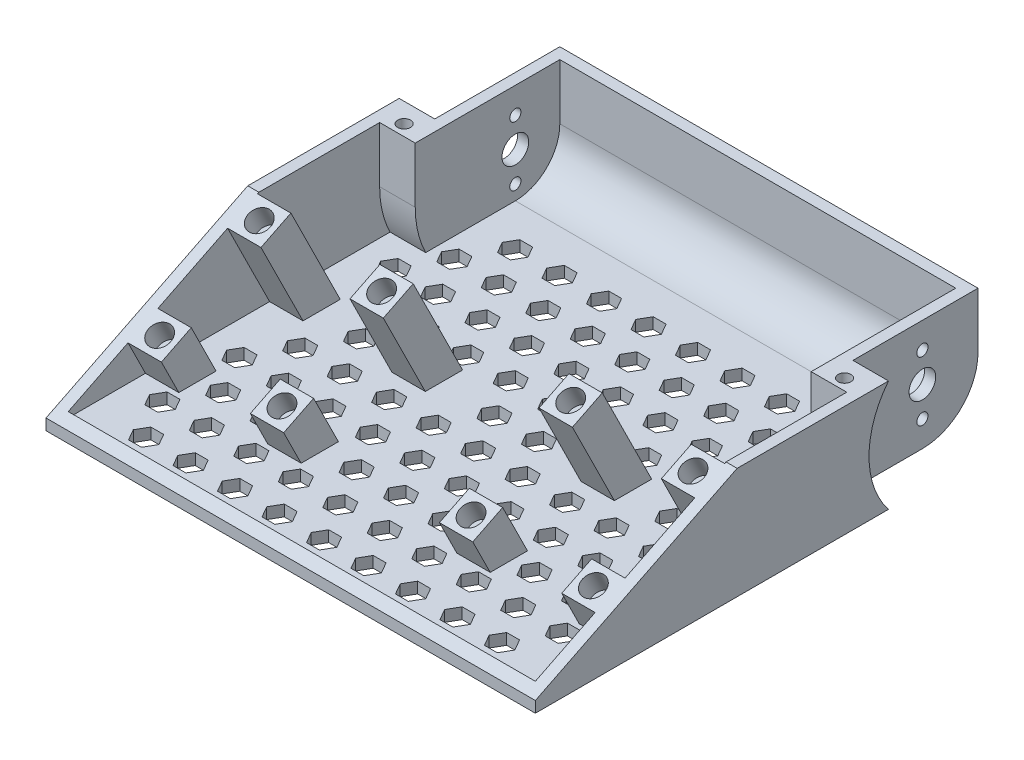
from build123d import *

# Parameters (mm, degrees)
BOSS_EXTRUDE2_DEPTH             = 69.85
SKETCH2_R                       = 25.4
CUT_EXTRUDE1_DEPTH              = 10.16
SHELL1_T                        = -3.175
M3_CLEARANCE_HOLE1_D            = 3.2
M3_CLEARANCE_HOLE1_CSINK_D      = 3.25
M3_CLEARANCE_HOLE1_CSINK_ANGLE  = 90
CUT_EXTRUDE2_DEPTH              = 156.206522817
BOSS_EXTRUDE3_REACH             = 120.195
SKETCH7_W                       = 9.525
SKETCH7_H                       = 9.525
F_1_4_0_25_DIAMETER_HOLE1_D     = 6.35
F_1_4_0_25_DIAMETER_HOLE1_DEPTH = 6.35
F_1_4_0_25_DIAMETER_HOLE1_TIP   = 1.907732465
BOSS_EXTRUDE4_REACH             = 112.397
BOSS_EXTRUDE4_END_RADIUS        = 28.575
SKETCH16_W                      = 10.16
SKETCH16_H                      = 4.815475594
F_6_CLEARANCE_HOLE1_D           = 3.6576
F_6_CLEARANCE_HOLE1_DEPTH       = 6.35
F_6_CLEARANCE_HOLE1_TIP         = 1.0988539
CUT_EXTRUDE3_REACH              = 111.526
FILL_PATTERN1_DEPTH             = 3.175


# Read off the part's stored shape, not the designer's step: Fill Pattern1
with BuildPart() as part:
    # Sketch1 → Boss-Extrude2 (new, symmetric)
    with BuildSketch(Plane(origin=(0, 0, 0), x_dir=(0, 0, -1), z_dir=(1, 0, 0))):
        with BuildLine():
            Line((-57.15, 3.15251797), (-57.15, 0))
            Line((-57.15, 0), (63.5, 0))
            ThreePointArc((63.5, 0), (74.725320151, 4.649679849), (79.375, 15.875))
            Line((79.375, 15.875), (79.375, 31.75))
            Line((79.375, 31.75), (0.452847189, 31.75))
            Line((0.452847189, 31.75), (-57.15, 3.15251797))
        make_face()
    extrude(amount=BOSS_EXTRUDE2_DEPTH, both=True)

    # Sketch2 → Cut-Extrude1 (cut)
    with BuildSketch(Plane(origin=(69.85, 0, 0), x_dir=(0, 0, -1), z_dir=(1, 0, 0))):
        with Locations((63.5, 15.875)):
            Circle(SKETCH2_R)
    cut_extrude1 = extrude(amount=-CUT_EXTRUDE1_DEPTH, mode=Mode.SUBTRACT)

    # Mirror1: Cut-Extrude1 across plane
    add(cut_extrude1.mirror(Plane(origin=(0, 0, 0), x_dir=(0, 0, 1), z_dir=(1, 0, 0))), mode=Mode.SUBTRACT)

    # Shell1
    shell1_openings = [part.faces().sort_by_distance(p)[0] for p in [
        (0, 17.451258985, 28.348576405),
        (0, 31.75, -38.391836194),
    ]]
    offset(amount=SHELL1_T, openings=shell1_openings, kind=Kind.INTERSECTION)

    # M3 Clearance Hole1 (through all)
    with Locations(Plane.ZY.offset(59.69)):
        with Locations((-63.5, 24.375), (-63.5, 7.375)):
            CounterSinkHole(M3_CLEARANCE_HOLE1_D / 2, M3_CLEARANCE_HOLE1_CSINK_D / 2, counter_sink_angle=M3_CLEARANCE_HOLE1_CSINK_ANGLE)

    # Sketch3 → Cut-Extrude2 (cut, through all)
    with BuildSketch(Plane.ZY.offset(59.69)):
        with BuildLine():
            ThreePointArc((-63.5, 19.685), (-67.31, 15.875), (-63.5, 12.065))
            Line((-63.5, 12.065), (-63.5, 19.685))
        make_face()
        with BuildLine():
            Line((-63.5, 19.685), (-63.5, 12.065))
            ThreePointArc((-63.5, 12.065), (-60.805923164, 13.180923164), (-59.69, 15.875))
            ThreePointArc((-59.69, 15.875), (-60.805923164, 18.569076836), (-63.5, 19.685))
        make_face()
    extrude(amount=-CUT_EXTRUDE2_DEPTH, mode=Mode.SUBTRACT)

    # Boss-Extrude3: up to this plane
    boss_extrude3_end = Plane(origin=(69.85, 3.175, 0), z_dir=(0, 1, 0))
    # Sketch7 → Boss-Extrude3 (add, up to the surface)
    with BuildSketch(Plane(origin=(0, 25.291525392, 12.556218628), x_dir=(1, 0, 0), z_dir=(0, 0.8956920640351826, 0.44467485472465634)), mode=Mode.PRIVATE) as boss_extrude3_sk1:
        with Locations((-61.9125, -22.429710951)):
            Rectangle(SKETCH7_W, SKETCH7_H)
    boss_extrude3_tool1 = split(extrude(boss_extrude3_sk1.sketch, amount=-BOSS_EXTRUDE3_REACH, mode=Mode.PRIVATE), bisect_by=boss_extrude3_end, keep=Keep.BOTH, mode=Mode.PRIVATE)
    add(boss_extrude3_tool1.solids().sort_by_distance((-61.9125, 15.317597, 32.646333))[0])
    # Sketch7 → Boss-Extrude3 (add, up to the surface)
    with BuildSketch(Plane(origin=(0, 25.291525392, 12.556218628), x_dir=(1, 0, 0), z_dir=(0, 0.8956920640351826, 0.44467485472465634)), mode=Mode.PRIVATE) as boss_extrude3_sk2:
        with Locations((-61.9125, 9.320289049)):
            Rectangle(SKETCH7_W, SKETCH7_H)
    boss_extrude3_tool2 = split(extrude(boss_extrude3_sk2.sketch, amount=-BOSS_EXTRUDE3_REACH, mode=Mode.PRIVATE), bisect_by=boss_extrude3_end, keep=Keep.BOTH, mode=Mode.PRIVATE)
    add(boss_extrude3_tool2.solids().sort_by_distance((-61.9125, 29.436024, 4.20811))[0])
    # Sketch7 → Boss-Extrude3 (add, up to the surface)
    with BuildSketch(Plane(origin=(0, 25.291525392, 12.556218628), x_dir=(1, 0, 0), z_dir=(0, 0.8956920640351826, 0.44467485472465634)), mode=Mode.PRIVATE) as boss_extrude3_sk3:
        with Locations((61.9125, 9.320289049)):
            Rectangle(SKETCH7_W, SKETCH7_H)
    boss_extrude3_tool3 = split(extrude(boss_extrude3_sk3.sketch, amount=-BOSS_EXTRUDE3_REACH, mode=Mode.PRIVATE), bisect_by=boss_extrude3_end, keep=Keep.BOTH, mode=Mode.PRIVATE)
    add(boss_extrude3_tool3.solids().sort_by_distance((61.9125, 29.436024, 4.20811))[0])
    # Sketch7 → Boss-Extrude3 (add, up to the surface)
    with BuildSketch(Plane(origin=(0, 25.291525392, 12.556218628), x_dir=(1, 0, 0), z_dir=(0, 0.8956920640351826, 0.44467485472465634)), mode=Mode.PRIVATE) as boss_extrude3_sk4:
        with Locations((61.9125, -22.429710951)):
            Rectangle(SKETCH7_W, SKETCH7_H)
    boss_extrude3_tool4 = split(extrude(boss_extrude3_sk4.sketch, amount=-BOSS_EXTRUDE3_REACH, mode=Mode.PRIVATE), bisect_by=boss_extrude3_end, keep=Keep.BOTH, mode=Mode.PRIVATE)
    add(boss_extrude3_tool4.solids().sort_by_distance((61.9125, 15.317597, 32.646333))[0])
    # Sketch7 → Boss-Extrude3 (add, up to the surface)
    with BuildSketch(Plane(origin=(0, 25.291525392, 12.556218628), x_dir=(1, 0, 0), z_dir=(0, 0.8956920640351826, 0.44467485472465634)), mode=Mode.PRIVATE) as boss_extrude3_sk5:
        with Locations((-26.9875, 9.320289049)):
            Rectangle(SKETCH7_W, SKETCH7_H)
    boss_extrude3_tool5 = split(extrude(boss_extrude3_sk5.sketch, amount=-BOSS_EXTRUDE3_REACH, mode=Mode.PRIVATE), bisect_by=boss_extrude3_end, keep=Keep.BOTH, mode=Mode.PRIVATE)
    add(boss_extrude3_tool5.solids().sort_by_distance((-26.9875, 29.436024, 4.20811))[0])
    # Sketch7 → Boss-Extrude3 (add, up to the surface)
    with BuildSketch(Plane(origin=(0, 25.291525392, 12.556218628), x_dir=(1, 0, 0), z_dir=(0, 0.8956920640351826, 0.44467485472465634)), mode=Mode.PRIVATE) as boss_extrude3_sk6:
        with Locations((-26.9875, -22.429710951)):
            Rectangle(SKETCH7_W, SKETCH7_H)
    boss_extrude3_tool6 = split(extrude(boss_extrude3_sk6.sketch, amount=-BOSS_EXTRUDE3_REACH, mode=Mode.PRIVATE), bisect_by=boss_extrude3_end, keep=Keep.BOTH, mode=Mode.PRIVATE)
    add(boss_extrude3_tool6.solids().sort_by_distance((-26.9875, 15.317597, 32.646333))[0])
    # Sketch7 → Boss-Extrude3 (add, up to the surface)
    with BuildSketch(Plane(origin=(0, 25.291525392, 12.556218628), x_dir=(1, 0, 0), z_dir=(0, 0.8956920640351826, 0.44467485472465634)), mode=Mode.PRIVATE) as boss_extrude3_sk7:
        with Locations((26.9875, -22.429710951)):
            Rectangle(SKETCH7_W, SKETCH7_H)
    boss_extrude3_tool7 = split(extrude(boss_extrude3_sk7.sketch, amount=-BOSS_EXTRUDE3_REACH, mode=Mode.PRIVATE), bisect_by=boss_extrude3_end, keep=Keep.BOTH, mode=Mode.PRIVATE)
    add(boss_extrude3_tool7.solids().sort_by_distance((26.9875, 15.317597, 32.646333))[0])
    # Sketch7 → Boss-Extrude3 (add, up to the surface)
    with BuildSketch(Plane(origin=(0, 25.291525392, 12.556218628), x_dir=(1, 0, 0), z_dir=(0, 0.8956920640351826, 0.44467485472465634)), mode=Mode.PRIVATE) as boss_extrude3_sk8:
        with Locations((26.9875, 9.320289049)):
            Rectangle(SKETCH7_W, SKETCH7_H)
    boss_extrude3_tool8 = split(extrude(boss_extrude3_sk8.sketch, amount=-BOSS_EXTRUDE3_REACH, mode=Mode.PRIVATE), bisect_by=boss_extrude3_end, keep=Keep.BOTH, mode=Mode.PRIVATE)
    add(boss_extrude3_tool8.solids().sort_by_distance((26.9875, 29.436024, 4.20811))[0])

    # 1/4 (0.25) Diameter Hole1
    with Locations(Plane(origin=(0, 25.291525392, 12.556218628), x_dir=(1, 0, 0), z_dir=(0, 0.8956920640351826, 0.4446748547246564))):
        with Locations((-61.9125, 9.320289049), (-61.9125, -22.429710951), (61.9125, -22.429710951), (61.9125, 9.320289049), (-26.9875, 9.320289049), (26.9875, 9.320289049), (26.9875, -22.429710951), (-26.9875, -22.429710951)):
            Hole(F_1_4_0_25_DIAMETER_HOLE1_D / 2, depth=F_1_4_0_25_DIAMETER_HOLE1_DEPTH)
            with Locations((0, 0, -(F_1_4_0_25_DIAMETER_HOLE1_DEPTH + F_1_4_0_25_DIAMETER_HOLE1_TIP / 2))):  # 118° drill point
                Cone(0, F_1_4_0_25_DIAMETER_HOLE1_D / 2, F_1_4_0_25_DIAMETER_HOLE1_TIP, mode=Mode.SUBTRACT)

    # Boss-Extrude4: up to this cylinder (the profile starts outside it)
    boss_extrude4_end = Plane(origin=(0, 15.875, -63.5), z_dir=(1, 0, 0)) * Cylinder(BOSS_EXTRUDE4_END_RADIUS, 406.134, mode=Mode.PRIVATE)
    # Sketch16 → Boss-Extrude4 (add, up to the surface)
    with BuildSketch(Plane(origin=(0, 31.75, 0), x_dir=(1, 0, 0), z_dir=(0, 1, 0)), mode=Mode.PRIVATE) as boss_extrude4_sk1:
        with Locations((61.595, 37.332737797)):
            Rectangle(SKETCH16_W, SKETCH16_H)
    boss_extrude4_tool1 = extrude(boss_extrude4_sk1.sketch, amount=-BOSS_EXTRUDE4_REACH, mode=Mode.PRIVATE) - boss_extrude4_end
    add(boss_extrude4_tool1.solids().sort_by_distance((61.595, 31.75, -37.332738))[0])
    # Sketch16 → Boss-Extrude4 (add, up to the surface)
    with BuildSketch(Plane(origin=(0, 31.75, 0), x_dir=(1, 0, 0), z_dir=(0, 1, 0)), mode=Mode.PRIVATE) as boss_extrude4_sk2:
        with Locations((-61.595, 37.332737797)):
            Rectangle(SKETCH16_W, SKETCH16_H)
    boss_extrude4_tool2 = extrude(boss_extrude4_sk2.sketch, amount=-BOSS_EXTRUDE4_REACH, mode=Mode.PRIVATE) - boss_extrude4_end
    add(boss_extrude4_tool2.solids().sort_by_distance((-61.595, 31.75, -37.332738))[0])

    # #6 Clearance Hole1
    with Locations(Plane(origin=(0, 31.75, 0), x_dir=(1, 0, 0), z_dir=(0, 1, 0))):
        with Locations((-62.865, 38.1), (62.865, 38.1)):
            Hole(F_6_CLEARANCE_HOLE1_D / 2, depth=F_6_CLEARANCE_HOLE1_DEPTH)
            with Locations((0, 0, -(F_6_CLEARANCE_HOLE1_DEPTH + F_6_CLEARANCE_HOLE1_TIP / 2))):  # 118° drill point
                Cone(0, F_6_CLEARANCE_HOLE1_D / 2, F_6_CLEARANCE_HOLE1_TIP, mode=Mode.SUBTRACT)

    # Sketch15 → Cut-Extrude3 (cut, up to next)
    with BuildSketch(Plane(origin=(0, 3.175, 0), x_dir=(1, 0, 0), z_dir=(0, 1, 0)), mode=Mode.PRIVATE) as cut_extrude3_sk1:
        Polygon((3.666174209, -47.625), (1.833087105, -44.45), (-1.833087105, -44.45), (-3.666174209, -47.625), (-1.833087105, -50.8), (1.833087105, -50.8), align=None)
    cut_extrude3_tool1 = extrude(cut_extrude3_sk1.sketch, amount=-CUT_EXTRUDE3_REACH, mode=Mode.PRIVATE) & part.part
    add(cut_extrude3_tool1.solids().sort_by_distance((0, 3.175, 47.625))[0], mode=Mode.SUBTRACT)

    # Fill Pattern1 outline → Fill Pattern1 (cut)
    with BuildSketch(Plane(origin=(0, 0, 0), x_dir=(1, 0, 0), z_dir=(0, 1, 0))):
        Polygon((4.516912895, -39.801477372), (8.183087105, -39.801477372), (10.016174209, -36.626477372), (8.183087105, -33.451477372), (4.516912895, -33.451477372), (2.683825791, -36.626477372), align=None)
        Polygon((10.866912895, -28.802954744), (14.533087105, -28.802954744), (16.366174209, -25.627954744), (14.533087105, -22.452954744), (10.866912895, -22.452954744), (9.033825791, -25.627954744), align=None)
        Polygon((17.216912895, -17.804432116), (20.883087105, -17.804432116), (22.716174209, -14.629432116), (20.883087105, -11.454432116), (17.216912895, -11.454432116), (15.383825791, -14.629432116), align=None)
        Polygon((23.566912895, -6.805909488), (27.233087105, -6.805909488), (29.066174209, -3.630909488), (27.233087105, -0.455909488), (23.566912895, -0.455909488), (21.733825791, -3.630909488), align=None)
        Polygon((48.966912895, 37.188181024), (52.633087105, 37.188181024), (54.466174209, 40.363181024), (52.633087105, 43.538181024), (48.966912895, 43.538181024), (47.133825791, 40.363181024), align=None)
        Polygon((42.616912895, 26.189658396), (46.283087105, 26.189658396), (48.116174209, 29.364658396), (46.283087105, 32.539658396), (42.616912895, 32.539658396), (40.783825791, 29.364658396), align=None)
        Polygon((36.266912895, 15.191135768), (39.933087105, 15.191135768), (41.766174209, 18.366135768), (39.933087105, 21.541135768), (36.266912895, 21.541135768), (34.433825791, 18.366135768), align=None)
        Polygon((9.033825791, -47.625), (10.866912895, -50.8), (14.533087105, -50.8), (16.366174209, -47.625), (14.533087105, -44.45), (10.866912895, -44.45), align=None)
        Polygon((34.433825791, -47.625), (36.266912895, -50.8), (39.933087105, -50.8), (41.766174209, -47.625), (39.933087105, -44.45), (36.266912895, -44.45), align=None)
        Polygon((47.133825791, -47.625), (48.966912895, -50.8), (52.633087105, -50.8), (54.466174209, -47.625), (52.633087105, -44.45), (48.966912895, -44.45), align=None)
        Polygon((21.733825791, -47.625), (23.566912895, -50.8), (27.233087105, -50.8), (29.066174209, -47.625), (27.233087105, -44.45), (23.566912895, -44.45), align=None)
        Polygon((-41.766174209, -47.625), (-39.933087105, -50.8), (-36.266912895, -50.8), (-34.433825791, -47.625), (-36.266912895, -44.45), (-39.933087105, -44.45), align=None)
        Polygon((-54.466174209, -47.625), (-52.633087105, -50.8), (-48.966912895, -50.8), (-47.133825791, -47.625), (-48.966912895, -44.45), (-52.633087105, -44.45), align=None)
        Polygon((-16.366174209, -47.625), (-14.533087105, -50.8), (-10.866912895, -50.8), (-9.033825791, -47.625), (-10.866912895, -44.45), (-14.533087105, -44.45), align=None)
        Polygon((-29.066174209, -47.625), (-27.233087105, -50.8), (-23.566912895, -50.8), (-21.733825791, -47.625), (-23.566912895, -44.45), (-27.233087105, -44.45), align=None)
        Polygon((-39.933087105, 21.541135768), (-41.766174209, 18.366135768), (-39.933087105, 15.191135768), (-36.266912895, 15.191135768), (-34.433825791, 18.366135768), (-36.266912895, 21.541135768), align=None)
        Polygon((-46.283087105, 32.539658396), (-48.116174209, 29.364658396), (-46.283087105, 26.189658396), (-42.616912895, 26.189658396), (-40.783825791, 29.364658396), (-42.616912895, 32.539658396), align=None)
        Polygon((-52.633087105, 43.538181024), (-54.466174209, 40.363181024), (-52.633087105, 37.188181024), (-48.966912895, 37.188181024), (-47.133825791, 40.363181024), (-48.966912895, 43.538181024), align=None)
        Polygon((-8.183087105, -33.451477372), (-10.016174209, -36.626477372), (-8.183087105, -39.801477372), (-4.516912895, -39.801477372), (-2.683825791, -36.626477372), (-4.516912895, -33.451477372), align=None)
        Polygon((-20.883087105, -11.454432116), (-22.716174209, -14.629432116), (-20.883087105, -17.804432116), (-17.216912895, -17.804432116), (-15.383825791, -14.629432116), (-17.216912895, -11.454432116), align=None)
        Polygon((-27.233087105, -0.455909488), (-29.066174209, -3.630909488), (-27.233087105, -6.805909488), (-23.566912895, -6.805909488), (-21.733825791, -3.630909488), (-23.566912895, -0.455909488), align=None)
        Polygon((-14.533087105, -22.452954744), (-16.366174209, -25.627954744), (-14.533087105, -28.802954744), (-10.866912895, -28.802954744), (-9.033825791, -25.627954744), (-10.866912895, -22.452954744), align=None)
        Polygon((55.316912895, -39.801477372), (58.983087105, -39.801477372), (60.816174209, -36.626477372), (58.983087105, -33.451477372), (55.316912895, -33.451477372), (53.483825791, -36.626477372), align=None)
        Polygon((-60.816174209, -36.626477372), (-58.983087105, -39.801477372), (-55.316912895, -39.801477372), (-53.483825791, -36.626477372), (-55.316912895, -33.451477372), (-58.983087105, -33.451477372), align=None)
        Polygon((40.783825791, -36.626477372), (42.616912895, -39.801477372), (46.283087105, -39.801477372), (48.116174209, -36.626477372), (46.283087105, -33.451477372), (42.616912895, -33.451477372), align=None)
        Polygon((15.383825791, -36.626477372), (17.216912895, -39.801477372), (20.883087105, -39.801477372), (22.716174209, -36.626477372), (20.883087105, -33.451477372), (17.216912895, -33.451477372), align=None)
        Polygon((28.083825791, -36.626477372), (29.916912895, -39.801477372), (33.583087105, -39.801477372), (35.416174209, -36.626477372), (33.583087105, -33.451477372), (29.916912895, -33.451477372), align=None)
        Polygon((-35.416174209, -36.626477372), (-33.583087105, -39.801477372), (-29.916912895, -39.801477372), (-28.083825791, -36.626477372), (-29.916912895, -33.451477372), (-33.583087105, -33.451477372), align=None)
        Polygon((-48.116174209, -36.626477372), (-46.283087105, -39.801477372), (-42.616912895, -39.801477372), (-40.783825791, -36.626477372), (-42.616912895, -33.451477372), (-46.283087105, -33.451477372), align=None)
        Polygon((-22.716174209, -36.626477372), (-20.883087105, -39.801477372), (-17.216912895, -39.801477372), (-15.383825791, -36.626477372), (-17.216912895, -33.451477372), (-20.883087105, -33.451477372), align=None)
        Polygon((23.566912895, 21.541135768), (21.733825791, 18.366135768), (23.566912895, 15.191135768), (27.233087105, 15.191135768), (29.066174209, 18.366135768), (27.233087105, 21.541135768), align=None)
        Polygon((42.616912895, -11.454432116), (40.783825791, -14.629432116), (42.616912895, -17.804432116), (46.283087105, -17.804432116), (48.116174209, -14.629432116), (46.283087105, -11.454432116), align=None)
        Polygon((48.966912895, -22.452954744), (47.133825791, -25.627954744), (48.966912895, -28.802954744), (52.633087105, -28.802954744), (54.466174209, -25.627954744), (52.633087105, -22.452954744), align=None)
        Polygon((36.266912895, -0.455909488), (34.433825791, -3.630909488), (36.266912895, -6.805909488), (39.933087105, -6.805909488), (41.766174209, -3.630909488), (39.933087105, -0.455909488), align=None)
        Polygon((4.516912895, 54.536703653), (2.683825791, 51.361703653), (4.516912895, 48.186703653), (8.183087105, 48.186703653), (10.016174209, 51.361703653), (8.183087105, 54.536703653), align=None)
        Polygon((17.216912895, 32.539658396), (15.383825791, 29.364658396), (17.216912895, 26.189658396), (20.883087105, 26.189658396), (22.716174209, 29.364658396), (20.883087105, 32.539658396), align=None)
        Polygon((10.866912895, 43.538181024), (9.033825791, 40.363181024), (10.866912895, 37.188181024), (14.533087105, 37.188181024), (16.366174209, 40.363181024), (14.533087105, 43.538181024), align=None)
        Polygon((-46.283087105, 4.19261314), (-42.616912895, 4.19261314), (-40.783825791, 7.36761314), (-42.616912895, 10.54261314), (-46.283087105, 10.54261314), (-48.116174209, 7.36761314), align=None)
        Polygon((-52.633087105, -6.805909488), (-48.966912895, -6.805909488), (-47.133825791, -3.630909488), (-48.966912895, -0.455909488), (-52.633087105, -0.455909488), (-54.466174209, -3.630909488), align=None)
        Polygon((-58.983087105, -17.804432116), (-55.316912895, -17.804432116), (-53.483825791, -14.629432116), (-55.316912895, -11.454432116), (-58.983087105, -11.454432116), (-60.816174209, -14.629432116), align=None)
        Polygon((-33.583087105, 26.189658396), (-29.916912895, 26.189658396), (-28.083825791, 29.364658396), (-29.916912895, 32.539658396), (-33.583087105, 32.539658396), (-35.416174209, 29.364658396), align=None)
        Polygon((-27.233087105, 37.188181024), (-23.566912895, 37.188181024), (-21.733825791, 40.363181024), (-23.566912895, 43.538181024), (-27.233087105, 43.538181024), (-29.066174209, 40.363181024), align=None)
        Polygon((-20.883087105, 48.186703653), (-17.216912895, 48.186703653), (-15.383825791, 51.361703653), (-17.216912895, 54.536703653), (-20.883087105, 54.536703653), (-22.716174209, 51.361703653), align=None)
        Polygon((-54.466174209, 18.366135768), (-52.633087105, 15.191135768), (-48.966912895, 15.191135768), (-47.133825791, 18.366135768), (-48.966912895, 21.541135768), (-52.633087105, 21.541135768), align=None)
        Polygon((-29.066174209, 18.366135768), (-27.233087105, 15.191135768), (-23.566912895, 15.191135768), (-21.733825791, 18.366135768), (-23.566912895, 21.541135768), (-27.233087105, 21.541135768), align=None)
        Polygon((47.133825791, 18.366135768), (48.966912895, 15.191135768), (52.633087105, 15.191135768), (54.466174209, 18.366135768), (52.633087105, 21.541135768), (48.966912895, 21.541135768), align=None)
        Polygon((-16.366174209, 18.366135768), (-14.533087105, 15.191135768), (-10.866912895, 15.191135768), (-9.033825791, 18.366135768), (-10.866912895, 21.541135768), (-14.533087105, 21.541135768), align=None)
        Polygon((9.033825791, 18.366135768), (10.866912895, 15.191135768), (14.533087105, 15.191135768), (16.366174209, 18.366135768), (14.533087105, 21.541135768), (10.866912895, 21.541135768), align=None)
        Polygon((-3.666174209, 18.366135768), (-1.833087105, 15.191135768), (1.833087105, 15.191135768), (3.666174209, 18.366135768), (1.833087105, 21.541135768), (-1.833087105, 21.541135768), align=None)
        Polygon((40.783825791, 7.36761314), (42.616912895, 4.19261314), (46.283087105, 4.19261314), (48.116174209, 7.36761314), (46.283087105, 10.54261314), (42.616912895, 10.54261314), align=None)
        Polygon((2.683825791, 7.36761314), (4.516912895, 4.19261314), (8.183087105, 4.19261314), (10.016174209, 7.36761314), (8.183087105, 10.54261314), (4.516912895, 10.54261314), align=None)
        Polygon((-10.016174209, 7.36761314), (-8.183087105, 4.19261314), (-4.516912895, 4.19261314), (-2.683825791, 7.36761314), (-4.516912895, 10.54261314), (-8.183087105, 10.54261314), align=None)
        Polygon((-39.933087105, -0.455909488), (-41.766174209, -3.630909488), (-39.933087105, -6.805909488), (-36.266912895, -6.805909488), (-34.433825791, -3.630909488), (-36.266912895, -0.455909488), align=None)
        Polygon((-58.983087105, 32.539658396), (-60.816174209, 29.364658396), (-58.983087105, 26.189658396), (-55.316912895, 26.189658396), (-53.483825791, 29.364658396), (-55.316912895, 32.539658396), align=None)
        Polygon((-33.583087105, -11.454432116), (-35.416174209, -14.629432116), (-33.583087105, -17.804432116), (-29.916912895, -17.804432116), (-28.083825791, -14.629432116), (-29.916912895, -11.454432116), align=None)
        Polygon((9.033825791, -3.630909488), (10.866912895, -6.805909488), (14.533087105, -6.805909488), (16.366174209, -3.630909488), (14.533087105, -0.455909488), (10.866912895, -0.455909488), align=None)
        Polygon((47.133825791, -3.630909488), (48.966912895, -6.805909488), (52.633087105, -6.805909488), (54.466174209, -3.630909488), (52.633087105, -0.455909488), (48.966912895, -0.455909488), align=None)
        Polygon((-16.366174209, -3.630909488), (-14.533087105, -6.805909488), (-10.866912895, -6.805909488), (-9.033825791, -3.630909488), (-10.866912895, -0.455909488), (-14.533087105, -0.455909488), align=None)
        Polygon((-3.666174209, -3.630909488), (-1.833087105, -6.805909488), (1.833087105, -6.805909488), (3.666174209, -3.630909488), (1.833087105, -0.455909488), (-1.833087105, -0.455909488), align=None)
        Polygon((-46.283087105, -11.454432116), (-48.116174209, -14.629432116), (-46.283087105, -17.804432116), (-42.616912895, -17.804432116), (-40.783825791, -14.629432116), (-42.616912895, -11.454432116), align=None)
        Polygon((-39.933087105, -22.452954744), (-41.766174209, -25.627954744), (-39.933087105, -28.802954744), (-36.266912895, -28.802954744), (-34.433825791, -25.627954744), (-36.266912895, -22.452954744), align=None)
        Polygon((2.683825791, -14.629432116), (4.516912895, -17.804432116), (8.183087105, -17.804432116), (10.016174209, -14.629432116), (8.183087105, -11.454432116), (4.516912895, -11.454432116), align=None)
        Polygon((53.483825791, -14.629432116), (55.316912895, -17.804432116), (58.983087105, -17.804432116), (60.816174209, -14.629432116), (58.983087105, -11.454432116), (55.316912895, -11.454432116), align=None)
        Polygon((28.083825791, -14.629432116), (29.916912895, -17.804432116), (33.583087105, -17.804432116), (35.416174209, -14.629432116), (33.583087105, -11.454432116), (29.916912895, -11.454432116), align=None)
        Polygon((-10.016174209, -14.629432116), (-8.183087105, -17.804432116), (-4.516912895, -17.804432116), (-2.683825791, -14.629432116), (-4.516912895, -11.454432116), (-8.183087105, -11.454432116), align=None)
        Polygon((-52.633087105, -22.452954744), (-54.466174209, -25.627954744), (-52.633087105, -28.802954744), (-48.966912895, -28.802954744), (-47.133825791, -25.627954744), (-48.966912895, -22.452954744), align=None)
        Polygon((-33.583087105, 48.186703653), (-29.916912895, 48.186703653), (-28.083825791, 51.361703653), (-29.916912895, 54.536703653), (-33.583087105, 54.536703653), (-35.416174209, 51.361703653), align=None)
        Polygon((-39.933087105, 37.188181024), (-36.266912895, 37.188181024), (-34.433825791, 40.363181024), (-36.266912895, 43.538181024), (-39.933087105, 43.538181024), (-41.766174209, 40.363181024), align=None)
        Polygon((-48.116174209, 51.361703653), (-46.283087105, 48.186703653), (-42.616912895, 48.186703653), (-40.783825791, 51.361703653), (-42.616912895, 54.536703653), (-46.283087105, 54.536703653), align=None)
        Polygon((40.783825791, 51.361703653), (42.616912895, 48.186703653), (46.283087105, 48.186703653), (48.116174209, 51.361703653), (46.283087105, 54.536703653), (42.616912895, 54.536703653), align=None)
        Polygon((-10.016174209, 51.361703653), (-8.183087105, 48.186703653), (-4.516912895, 48.186703653), (-2.683825791, 51.361703653), (-4.516912895, 54.536703653), (-8.183087105, 54.536703653), align=None)
        Polygon((28.083825791, 51.361703653), (29.916912895, 48.186703653), (33.583087105, 48.186703653), (35.416174209, 51.361703653), (33.583087105, 54.536703653), (29.916912895, 54.536703653), align=None)
        Polygon((15.383825791, 51.361703653), (17.216912895, 48.186703653), (20.883087105, 48.186703653), (22.716174209, 51.361703653), (20.883087105, 54.536703653), (17.216912895, 54.536703653), align=None)
        Polygon((-20.883087105, 32.539658396), (-22.716174209, 29.364658396), (-20.883087105, 26.189658396), (-17.216912895, 26.189658396), (-15.383825791, 29.364658396), (-17.216912895, 32.539658396), align=None)
        Polygon((34.433825791, 40.363181024), (36.266912895, 37.188181024), (39.933087105, 37.188181024), (41.766174209, 40.363181024), (39.933087105, 43.538181024), (36.266912895, 43.538181024), align=None)
        Polygon((-3.666174209, 40.363181024), (-1.833087105, 37.188181024), (1.833087105, 37.188181024), (3.666174209, 40.363181024), (1.833087105, 43.538181024), (-1.833087105, 43.538181024), align=None)
        Polygon((-16.366174209, 40.363181024), (-14.533087105, 37.188181024), (-10.866912895, 37.188181024), (-9.033825791, 40.363181024), (-10.866912895, 43.538181024), (-14.533087105, 43.538181024), align=None)
        Polygon((21.733825791, 40.363181024), (23.566912895, 37.188181024), (27.233087105, 37.188181024), (29.066174209, 40.363181024), (27.233087105, 43.538181024), (23.566912895, 43.538181024), align=None)
        Polygon((-1.833087105, -22.452954744), (-3.666174209, -25.627954744), (-1.833087105, -28.802954744), (1.833087105, -28.802954744), (3.666174209, -25.627954744), (1.833087105, -22.452954744), align=None)
        Polygon((28.083825791, 29.364658396), (29.916912895, 26.189658396), (33.583087105, 26.189658396), (35.416174209, 29.364658396), (33.583087105, 32.539658396), (29.916912895, 32.539658396), align=None)
        Polygon((53.483825791, 29.364658396), (55.316912895, 26.189658396), (58.983087105, 26.189658396), (60.816174209, 29.364658396), (58.983087105, 32.539658396), (55.316912895, 32.539658396), align=None)
        Polygon((-10.016174209, 29.364658396), (-8.183087105, 26.189658396), (-4.516912895, 26.189658396), (-2.683825791, 29.364658396), (-4.516912895, 32.539658396), (-8.183087105, 32.539658396), align=None)
        Polygon((2.683825791, 29.364658396), (4.516912895, 26.189658396), (8.183087105, 26.189658396), (10.016174209, 29.364658396), (8.183087105, 32.539658396), (4.516912895, 32.539658396), align=None)
        Polygon((34.433825791, -25.627954744), (36.266912895, -28.802954744), (39.933087105, -28.802954744), (41.766174209, -25.627954744), (39.933087105, -22.452954744), (36.266912895, -22.452954744), align=None)
    extrude(amount=FILL_PATTERN1_DEPTH, mode=Mode.SUBTRACT)


solid = part.part
